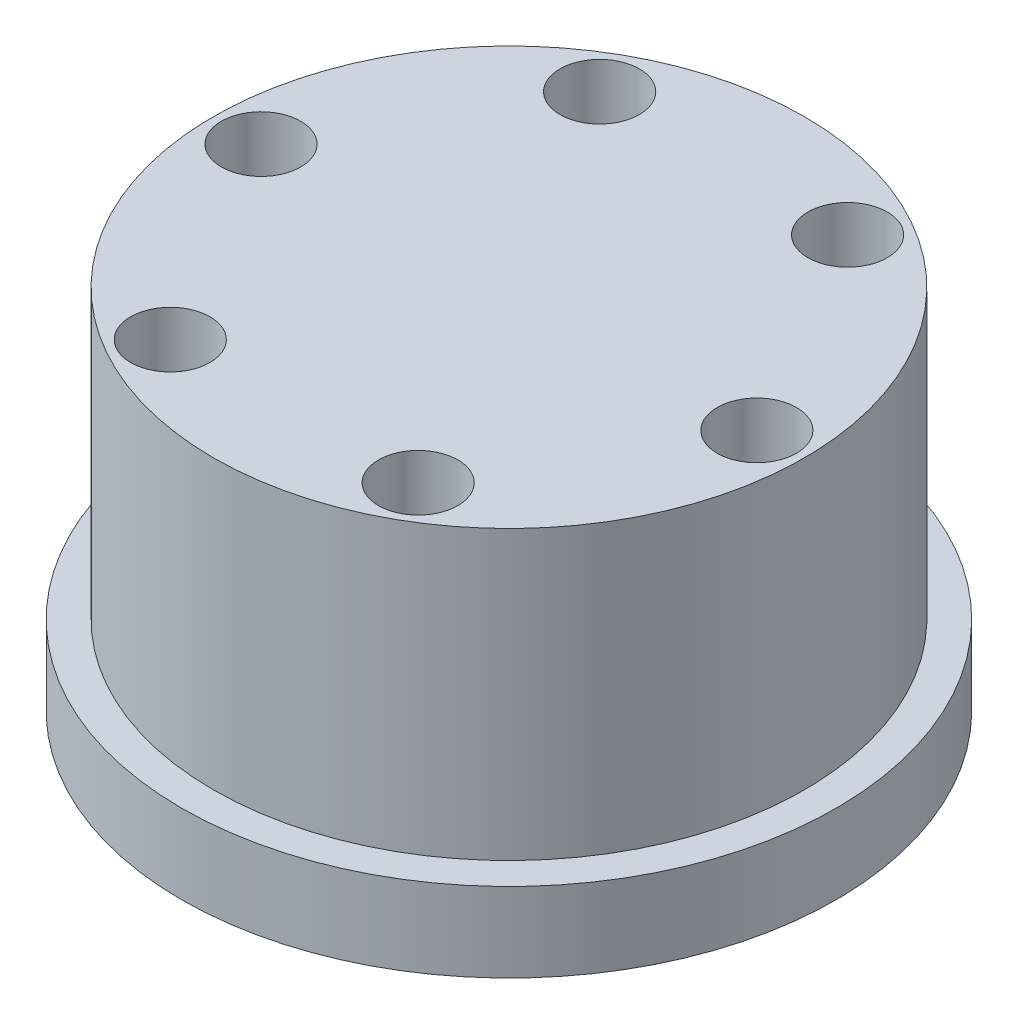
from build123d import *

# Parameters (mm, degrees)
SKETCH1_R           = 16.5
SKETCH1_R_2         = 1.5
BOSS_EXTRUDE1_DEPTH = 4
SKETCH2_R           = 14.9
BOSS_EXTRUDE2_DEPTH = 14.5
SKETCH3_R           = 9
CUT_EXTRUDE1_DEPTH  = 2
SKETCH4_R           = 6.6
CUT_EXTRUDE2_DEPTH  = 4
SKETCH5_R           = 2
CUT_EXTRUDE3_DEPTH  = 6.5


with BuildPart() as part:
    # Sketch1 → Boss-Extrude1 (new body)
    with BuildSketch(Plane(origin=(0, 0, 0), x_dir=(1, 0, 0), z_dir=(0, 1, 0))):
        Circle(SKETCH1_R)
        with Locations((0, 12.5)):
            Circle(SKETCH1_R_2, mode=Mode.SUBTRACT)
        with Locations((10.825317547, 6.25)):
            Circle(SKETCH1_R_2, mode=Mode.SUBTRACT)
        with Locations((10.825317547, -6.25)):
            Circle(SKETCH1_R_2, mode=Mode.SUBTRACT)
        with Locations((0, -12.5)):
            Circle(SKETCH1_R_2, mode=Mode.SUBTRACT)
        with Locations((-10.825317547, -6.25)):
            Circle(SKETCH1_R_2, mode=Mode.SUBTRACT)
        with Locations((-10.825317547, 6.25)):
            Circle(SKETCH1_R_2, mode=Mode.SUBTRACT)
    extrude(amount=BOSS_EXTRUDE1_DEPTH)

    # Sketch2 → Boss-Extrude2 (add)
    with BuildSketch(Plane(origin=(0, 4, 0), x_dir=(1, 0, 0), z_dir=(0, 1, 0))):
        Circle(SKETCH2_R)
    extrude(amount=BOSS_EXTRUDE2_DEPTH)

    # Sketch3 → Cut-Extrude1 (cut)
    with BuildSketch(Plane.XZ):
        Circle(SKETCH3_R)
    extrude(amount=-CUT_EXTRUDE1_DEPTH, mode=Mode.SUBTRACT)

    # Sketch4 → Cut-Extrude2 (cut)
    with BuildSketch(Plane.XZ.offset(-2)):
        Circle(SKETCH4_R)
    extrude(amount=-CUT_EXTRUDE2_DEPTH, mode=Mode.SUBTRACT)

    # Sketch5 → Cut-Extrude3 (cut)
    with BuildSketch(Plane(origin=(0, 18.5, 0), x_dir=(1, 0, 0), z_dir=(0, 1, 0))):
        with Locations((-12.5, 0)):
            Circle(SKETCH5_R)
        with Locations((-6.25, 10.825317547)):
            Circle(SKETCH5_R)
        with Locations((6.25, 10.825317547)):
            Circle(SKETCH5_R)
        with Locations((12.5, 0)):
            Circle(SKETCH5_R)
        with Locations((6.25, -10.825317547)):
            Circle(SKETCH5_R)
        with Locations((-6.25, -10.825317547)):
            Circle(SKETCH5_R)
    extrude(amount=-CUT_EXTRUDE3_DEPTH, mode=Mode.SUBTRACT)


solid = part.part
